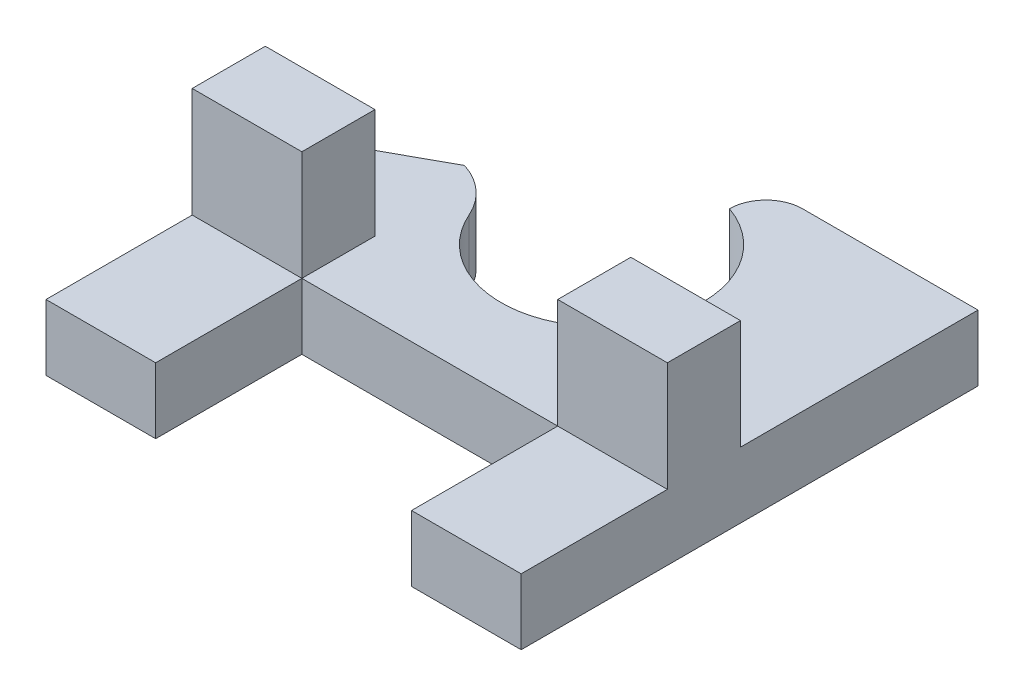
from build123d import *

# Parameters (mm, degrees)
BOSS_EXTRUDE1_DEPTH = 1.8
FILLET1_R           = 2
FILLET3_R           = 1
SKETCH2_W           = 3
SKETCH2_H           = 2
BOSS_EXTRUDE2_DEPTH = 3


# Some blends are built 0.0001 mm under size
with BuildPart() as part:
    # Sketch1 → Boss-Extrude1 (new body)
    with BuildSketch(Plane(origin=(0, 0, 0), x_dir=(1, 0, 0), z_dir=(0, 1, 0))):
        with BuildLine():
            Line((6.5, 2.5), (6.5, 0))
            Line((6.5, 0), (6.5, -4))
            Line((6.5, -4), (3.5, -4))
            Line((3.5, -4), (3.5, 0))
            Line((3.5, 0), (-3.5, 0))
            Line((-3.5, 0), (-3.5, -4))
            Line((-3.5, -4), (-6.5, -4))
            Line((-6.5, -4), (-6.5, 0))
            Line((-6.5, 0), (-6.5, 2.5))
            Line((-6.5, 2.5), (-6.5, 3.5))
            Line((-6.5, 3.5), (-3.95, 4.9))
            Line((-3.95, 4.9), (-2.95, 4.9))
            ThreePointArc((-2.95, 4.9), (-0.2, 2.15), (2.55, 4.9))
            ThreePointArc((2.55, 4.9), (2.040256682, 6.494913791), (0.7, 7.498557292))
            Line((0.7, 7.498557292), (0.7, 8.498557292))
            Line((0.7, 8.498557292), (6.5, 8.498557292))
            Line((6.5, 8.498557292), (6.5, 4.9))
            Line((6.5, 4.9), (6.5, 2.5))
        make_face()
    extrude(amount=BOSS_EXTRUDE1_DEPTH)

    # Fillet1
    # the kernel refuses this fillet: 2 mm, written as the material it takes off along each edge
    with BuildSketch(Plane(origin=(-2.95, -2.821440468, -4.9), x_dir=(0.20519567041703107, 0, 0.9787209698591857), z_dir=(0, 1, 0))) as fillet1_piece_1:
        with BuildLine():
            CenterArc((1.538967528, -1.95744194), FILLET1_R, 101.840953646, 48.860489585)
            Line((-0.20519567, -0.97872097), (-0.240078934, -0.95914655))
            ThreePointArc((-0.240078934, -0.95914655), (-0.141746674, -0.481152658), (-0.039148839, 0.008207827))
            Line((-0.039148839, 0.008207827), (0.008207827, 0.039148839))
            ThreePointArc((0.008207827, 0.039148839), (0.564288094, -0.018517333), (1.12036836, 0.039148839))
            Line((1.12036836, 0.039148839), (1.128576187, 0))
        make_face()
    extrude(amount=7.442880936, mode=Mode.SUBTRACT)

    # Fillet3
    fillet3_edges = [part.edges().sort_by_distance(p)[0] for p in [
        (0.7, 0.9, -8.498557292),
    ]]
    fillet(fillet3_edges, radius=FILLET3_R - 0.0001)  # a hair under: the kernel refuses the full size

    # Sketch2 → Boss-Extrude2 (add)
    with BuildSketch(Plane.XZ):
        with Locations((5, -1)):
            Rectangle(SKETCH2_W, SKETCH2_H)
        with Locations((-5, -1)):
            Rectangle(SKETCH2_W, SKETCH2_H)
    extrude(amount=BOSS_EXTRUDE2_DEPTH)


with BuildPart() as body_2:
    # Mirror3: mirrored copy
    add(part.part.mirror(Plane(origin=(0, 0, 0), x_dir=(0, 0, 1), z_dir=(0, -1, 0))))


solid = body_2.part
